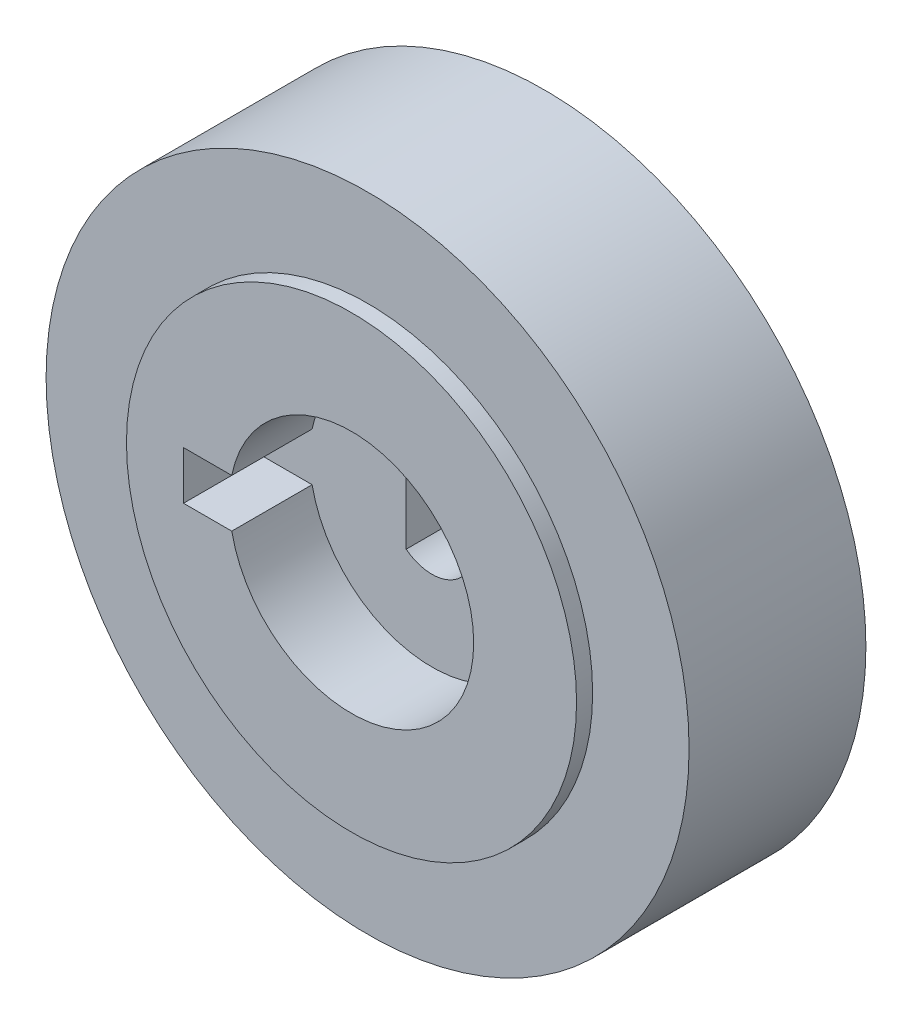
from build123d import *

# Parameters (mm, degrees)
SKETCH_1_R          = 13
SKETCH_1_R_2        = 2.6
SKETCH_1_R_3        = 1.4
EXTRUDE_1_DEPTH     = 4
SKETCH_1_3_R        = 13
SKETCH_1_3_R_2      = 2.6
EXTRUDE_2_DEPTH     = 12
EXTRUDE_START       = 11
SKETCH_1_6_R        = 14
SKETCH_1_6_R_2      = 13
EXTRUDE_3_DEPTH     = 1
CUT_EXTRUDE_1_DEPTH = 5
SKETCH_6_R          = 7.6
SKETCH_6_W          = 3
SKETCH_6_H          = 3
CUT_EXTRUDE_5_DEPTH = 5
SKETCH_5_R          = 5
CUT_EXTRUDE_6_DEPTH = 2
FILLET_1_R          = 12
SKETCH_7_R          = 20
SKETCH_7_R_2        = 13
EXTRUDE_5_DEPTH     = 11


with BuildPart() as part:
    # 草图1 → 凸台-拉伸1 (new body)
    # profile 1 of 3: a face of its own
    with BuildSketch(Plane.XY):
        Circle(SKETCH_1_R)
        Circle(SKETCH_1_R_2, mode=Mode.SUBTRACT)
    # profile 2 of 3: a face of its own
    with BuildSketch(Plane.XY):
        with BuildLine():
            Line((-1.6, -2.049390153), (-1.6, 2.049390153))
            ThreePointArc((-1.6, 2.049390153), (-2.6, 0), (-1.6, -2.049390153))
        make_face()
    # profile 3 of 3: a face of its own
    with BuildSketch(Plane.XY):
        with BuildLine():
            ThreePointArc((2.6, 0), (1.140175425, 2.336664289), (-1.6, 2.049390153))
            Line((-1.6, 2.049390153), (-1.6, -2.049390153))
            ThreePointArc((-1.6, -2.049390153), (1.140175425, -2.336664289), (2.6, 0))
        make_face()
        Circle(SKETCH_1_R_3, mode=Mode.SUBTRACT)
    extrude(amount=EXTRUDE_1_DEPTH)

    # 草图1<3> → 凸台-拉伸2 (add)
    # profile 1 of 2: a face of its own
    with BuildSketch(Plane.XY):
        Circle(SKETCH_1_3_R)
        Circle(SKETCH_1_3_R_2, mode=Mode.SUBTRACT)
    # profile 2 of 2: a face of its own
    with BuildSketch(Plane.XY):
        with BuildLine():
            Line((-1.6, -2.049390153), (-1.6, 2.049390153))
            ThreePointArc((-1.6, 2.049390153), (-2.6, 0), (-1.6, -2.049390153))
        make_face()
    extrude(amount=EXTRUDE_2_DEPTH)

    # 草图1<6> → 凸台-拉伸3 (add)
    with BuildSketch(Plane.XY.offset(EXTRUDE_START)):
        Circle(SKETCH_1_6_R)
        Circle(SKETCH_1_6_R_2, mode=Mode.SUBTRACT)
    extrude(amount=EXTRUDE_3_DEPTH)

    # 草图3 → 切除-拉伸1 (cut)
    with BuildSketch(Plane(origin=(0, 0, 0), x_dir=(-1, 0, 0), z_dir=(0, 0, -1))):
        with BuildLine():
            Line((-10.746987514, -5.338750731), (-4.305410284, -1.619704383))
            ThreePointArc((-4.305410284, -1.619704383), (-3.983716857, 2.3), (-0.75, 4.538446871))
            Line((-0.75, 4.538446871), (-0.75, 11.976539567))
            ThreePointArc((-0.75, 11.976539567), (-10.392304845, 6), (-10.746987514, -5.338750731))
        make_face()
        with BuildLine():
            Line((9.996987514, -6.637788836), (3.555410284, -2.918742488))
            ThreePointArc((3.555410284, -2.918742488), (0, -4.6), (-3.555410284, -2.918742488))
            Line((-3.555410284, -2.918742488), (-9.996987514, -6.637788836))
            ThreePointArc((-9.996987514, -6.637788836), (0, -12), (9.996987514, -6.637788836))
        make_face()
        with BuildLine():
            ThreePointArc((4.6, 0), (4.52575338, -0.823138109), (4.305410284, -1.619704383))
            Line((4.305410284, -1.619704383), (10.746987514, -5.338750731))
            ThreePointArc((10.746987514, -5.338750731), (11.682547885, -2.741910814), (12, 0))
            ThreePointArc((12, 0), (8.746427842, 8.215838363), (0.75, 11.976539567))
            Line((0.75, 11.976539567), (0.75, 4.538446871))
            ThreePointArc((0.75, 4.538446871), (3.507848343, 2.975735203), (4.6, 0))
        make_face()
    extrude(amount=-CUT_EXTRUDE_1_DEPTH, mode=Mode.SUBTRACT)

    # 草图6 → 切除-拉伸5 (cut)
    with BuildSketch(Plane.XY.offset(12)):
        Circle(SKETCH_6_R)
        with Locations((-8.950503339, 0)):
            Rectangle(SKETCH_6_W, SKETCH_6_H)
    extrude(amount=-CUT_EXTRUDE_5_DEPTH, mode=Mode.SUBTRACT)

    # 草图5 → 切除-拉伸6 (cut)
    with BuildSketch(Plane(origin=(0, 0, 0), x_dir=(-1, 0, 0), z_dir=(0, 0, -1))):
        Circle(SKETCH_5_R)
    extrude(amount=-CUT_EXTRUDE_6_DEPTH, mode=Mode.SUBTRACT)

    # 圆角1
    # the kernel refuses this fillet: 12 mm, written as the material it takes off along each edge
    with BuildSketch(Plane(origin=(0, 0, 0), x_dir=(-0.0031415874858860904, -0.9999950652018581, 0), z_dir=(0.9999950652018581, -0.0031415874858860904, 0))) as fillet_1_piece_1:
        with BuildLine():
            CenterArc((11.633249581, -12), FILLET_1_R, 90, 33.557309762)
            Line((5, -2), (5, 0))
            Line((5, 0), (11.633249581, 0))
        make_face()
    revolve(axis=Axis((0, 0, 0), (0, 0, -1)), revolution_arc=359.64, mode=Mode.SUBTRACT)
    with BuildSketch(Plane(origin=(0, 0, 0), x_dir=(0.8675919238668026, 0.49727683802998507, 0), z_dir=(-0.49727683802998507, 0.8675919238668026, 0))) as fillet_1_piece_2:
        with BuildLine():
            CenterArc((11.633249581, -12), FILLET_1_R, 90, 33.557309762)
            Line((5, -2), (5, 0))
            Line((5, 0), (11.633249581, 0))
        make_face()
    revolve(axis=Axis((0, 0, 0), (0, 0, -1)), revolution_arc=359.64, mode=Mode.SUBTRACT)
    with BuildSketch(Plane(origin=(0, 0, 0), x_dir=(-0.8644503363809427, 0.5027182271719167, 0), z_dir=(-0.5027182271719167, -0.8644503363809427, 0))) as fillet_1_piece_3:
        with BuildLine():
            CenterArc((11.633249581, -12), FILLET_1_R, 90, 33.557309762)
            Line((5, -2), (5, 0))
            Line((5, 0), (11.633249581, 0))
        make_face()
    revolve(axis=Axis((0, 0, 0), (0, 0, -1)), revolution_arc=359.64, mode=Mode.SUBTRACT)

    # 草图7 → 凸台-拉伸5 (add)
    with BuildSketch(Plane(origin=(0, 0, 11), x_dir=(-1, 0, 0), z_dir=(0, 0, -1)).offset(EXTRUDE_START)):
        with Locations(Location((0, 0, 0), (0, 0, 180))):
            Circle(SKETCH_7_R)
        Circle(SKETCH_7_R_2, mode=Mode.SUBTRACT)
    extrude(amount=-EXTRUDE_5_DEPTH)


solid = part.part
